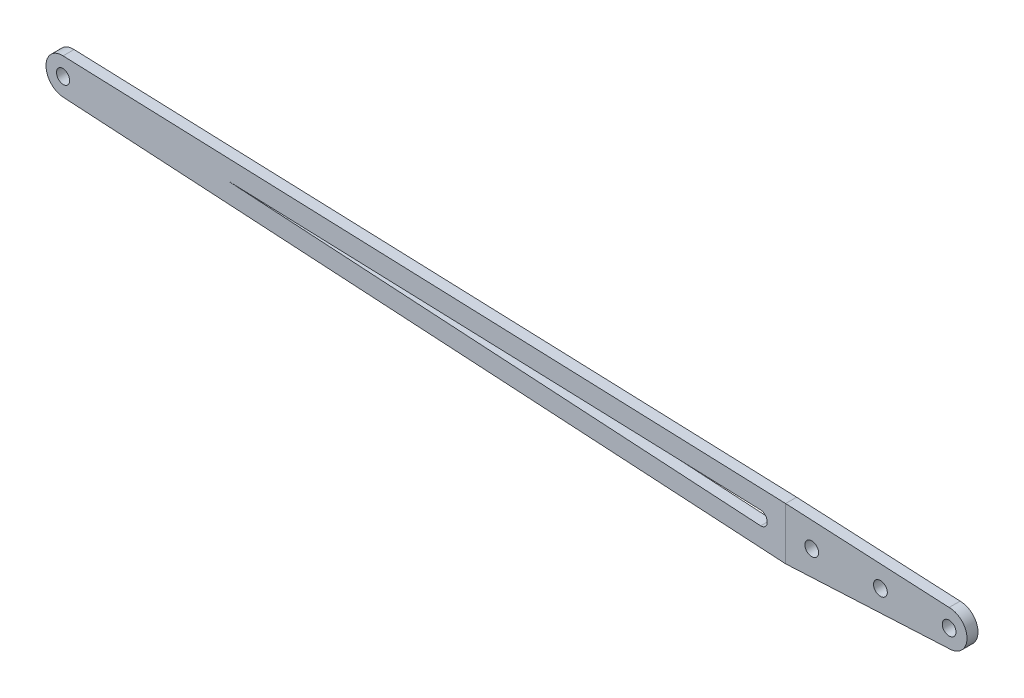
from build123d import *

# Parameters (mm, degrees)
BOSS_EXTRUDE1_DEPTH = 19
SKETCH2_R           = 2.5
CUT_EXTRUDE5_DEPTH  = 40


with BuildPart() as part:
    # Sketch1 → Boss-Extrude1 (new body)
    with BuildSketch(Plane(origin=(0, 0, 0), x_dir=(1, 0, 0), z_dir=(0, 1, 0))):
        Polygon((-66, 0), (0, 0), (0, 4), (-66, 4), (-348, 16.909), (-348, 12.909), align=None)
    extrude(amount=BOSS_EXTRUDE1_DEPTH)

    # Sketch2 → Cut-Extrude5 (cut)
    with BuildSketch(Plane.XY):
        with BuildLine():
            ThreePointArc((-6.5, 16), (-1.903805922, 14.096194078), (0, 9.5))
            Line((0, 9.5), (0, 19))
            Line((0, 19), (-66, 19))
            Line((-66, 19), (-6.5, 16))
        make_face()
        with BuildLine():
            Line((0, 0), (0, 9.5))
            ThreePointArc((0, 9.5), (-1.903805922, 4.903805922), (-6.5, 3))
            Line((-6.5, 3), (-66, 0))
            Line((-66, 0), (0, 0))
        make_face()
        with Locations((-6.5, 9.5)):
            Circle(SKETCH2_R)
        with BuildLine():
            Line((-75.5, 12), (-279, 9.5))
            Line((-279, 9.5), (-75.5, 7))
            ThreePointArc((-75.5, 7), (-73, 9.5), (-75.5, 12))
        make_face()
        with BuildLine():
            Line((-341.5, 16), (-66, 19))
            Line((-66, 19), (-348, 19))
            Line((-348, 19), (-348, 9.5))
            ThreePointArc((-348, 9.5), (-346.096194078, 14.096194078), (-341.5, 16))
        make_face()
        with BuildLine():
            Line((-348, 0), (-66, 0))
            Line((-66, 0), (-341.5, 3))
            ThreePointArc((-341.5, 3), (-346.096194078, 4.903805922), (-348, 9.5))
            Line((-348, 9.5), (-348, 0))
        make_face()
        with Locations((-31.5, 9.5)):
            Circle(SKETCH2_R)
        with Locations((-341.5, 9.5)):
            Circle(SKETCH2_R)
        with Locations((-56.5, 9.5)):
            Circle(SKETCH2_R)
    extrude(amount=-CUT_EXTRUDE5_DEPTH, mode=Mode.SUBTRACT)


solid = part.part
